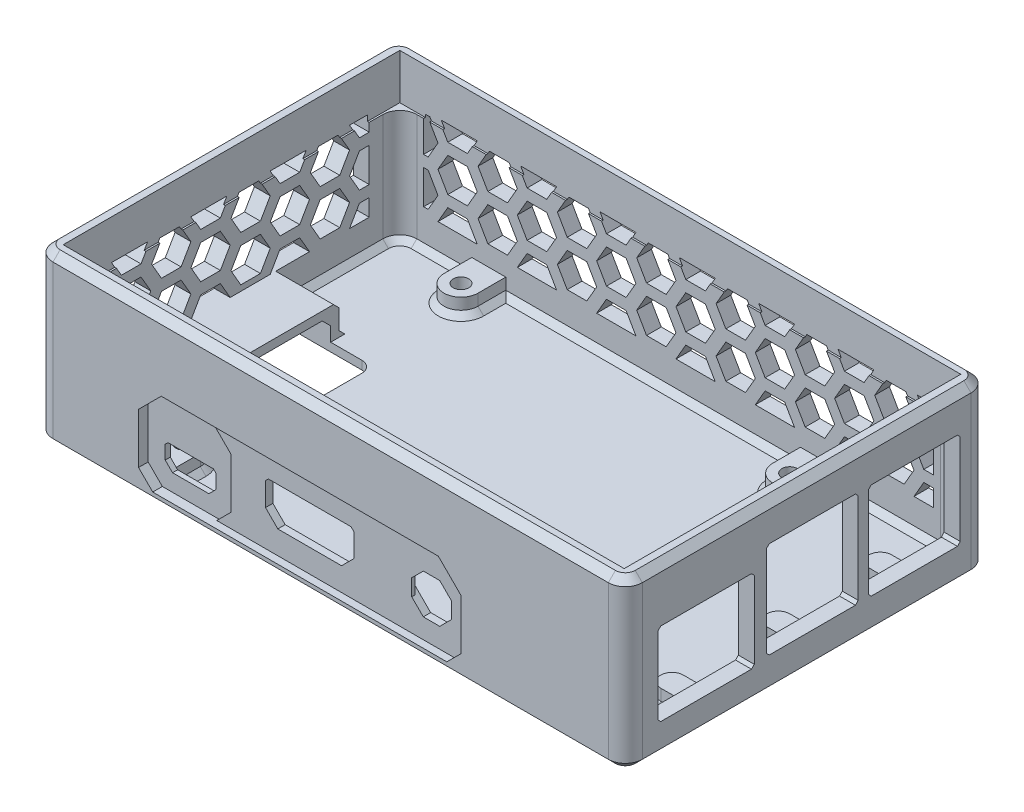
from build123d import *

# Parameters (mm, degrees)
SKETCH2_R               = 1.375
BOSS_EXTRUDE1_DEPTH     = 4.5
BOSS_EXTRUDE1_2_DEPTH   = 4.5
BOSS_EXTRUDE1_3_DEPTH   = 4.5
BOSS_EXTRUDE1_4_DEPTH   = 4.5
SKETCH4_W               = 104
SKETCH4_H               = 64
BOSS_EXTRUDE2_DEPTH     = 1.5
SKETCH5_R               = 2.6
CUT_EXTRUDE1_DEPTH      = 2.5
SKETCH6_W               = 104
SKETCH6_H               = 64
SKETCH6_W_2             = 99
SKETCH6_H_2             = 59.4
BOSS_EXTRUDE3_DEPTH     = 28
BOSS_EXTRUDE4_DEPTH     = 3
SKETCH18_W              = 99
SKETCH18_H              = 59.4
SKETCH18_W_2            = 98.4
SKETCH18_H_2            = 58.8
BOSS_EXTRUDE6_DEPTH     = 20
CUT_EXTRUDE8_DEPTH      = 2.6
CUT_EXTRUDE9_DEPTH      = 10
CUT_EXTRUDE2_DEPTH      = 121.292352209
SKETCH9_W               = 17
SKETCH9_H               = 14.6
SKETCH9_W_2             = 16.2
SKETCH9_H_2             = 17
CUT_EXTRUDE3_DEPTH      = 121.292352209
SKETCH11_W              = 56.9
SKETCH11_H              = 13.9
CUT_EXTRUDE4_DEPTH      = 1.3
SKETCH12_W              = 15
SKETCH12_H              = 13.9
CUT_EXTRUDE5_DEPTH      = 0.4
FILLET1_R               = 3
CHAMFER5_SIZE           = 2.5
CHAMFER1_SIZE           = 0.5
SKETCH20_W              = 13
SKETCH20_H              = 17
BOSS_EXTRUDE7_DEPTH     = 5.5
CHAMFER7_SIZE           = 1.25
CHAMFER3_SIZE           = 1
CUT_EXTRUDE6_DEPTH      = 4
CUT_EXTRUDE6_DEPTH_BACK = 120.933314805
CHAMFER9_SIZE           = 1.5
CHAMFER10_SIZE          = 0.7


with BuildPart() as part:
    # Sketch2 → Boss-Extrude1 (new body)
    with BuildSketch(Plane(origin=(0, 0, 0), x_dir=(1, 0, 0), z_dir=(0, 1, 0))):
        with BuildLine():
            Line((-84.5, -2.5), (-84.5, 3.5))
            ThreePointArc((-84.5, 3.5), (-81.5, 6.5), (-78.5, 3.5))
            Line((-78.5, 3.5), (-78.5, -2.5))
            Line((-78.5, -2.5), (-84.5, -2.5))
        make_face()
        with Locations(Location((-81.5, 3.5, 0), (0, 0, 270))):
            Circle(SKETCH2_R, mode=Mode.SUBTRACT)
    extrude(amount=BOSS_EXTRUDE1_DEPTH)



with BuildPart() as body_2:
    # Sketch2 → Boss-Extrude1 2 (new body)
    with BuildSketch(Plane(origin=(0, 0, 0), x_dir=(1, 0, 0), z_dir=(0, 1, 0))):
        with BuildLine():
            Line((-20.5, -2.5), (-26.5, -2.5))
            Line((-26.5, -2.5), (-26.5, 3.5))
            ThreePointArc((-26.5, 3.5), (-23.5, 6.5), (-20.5, 3.5))
            Line((-20.5, 3.5), (-20.5, -2.5))
        make_face()
        with Locations(Location((-23.5, 3.5, 0), (0, 0, 90))):
            Circle(SKETCH2_R, mode=Mode.SUBTRACT)
    extrude(amount=BOSS_EXTRUDE1_2_DEPTH)


with BuildPart() as body_3:
    # Sketch2 → Boss-Extrude1 3 (new body)
    with BuildSketch(Plane(origin=(0, 0, 0), x_dir=(1, 0, 0), z_dir=(0, 1, 0))):
        with BuildLine():
            Line((-20.5, 58.5), (-20.5, 52.5))
            ThreePointArc((-20.5, 52.5), (-23.5, 49.5), (-26.5, 52.5))
            Line((-26.5, 52.5), (-26.5, 58.5))
            Line((-26.5, 58.5), (-20.5, 58.5))
        make_face()
        with Locations(Location((-23.5, 52.5, 0), (0, 0, 270))):
            Circle(SKETCH2_R, mode=Mode.SUBTRACT)
    extrude(amount=BOSS_EXTRUDE1_3_DEPTH)


with BuildPart() as body_4:
    # Sketch2 → Boss-Extrude1 4 (new body)
    with BuildSketch(Plane(origin=(0, 0, 0), x_dir=(1, 0, 0), z_dir=(0, 1, 0))):
        with BuildLine():
            Line((-84.5, 58.5), (-78.5, 58.5))
            Line((-78.5, 58.5), (-78.5, 52.5))
            ThreePointArc((-78.5, 52.5), (-81.5, 49.5), (-84.5, 52.5))
            Line((-84.5, 52.5), (-84.5, 58.5))
        make_face()
        with Locations(Location((-81.5, 52.5, 0), (0, 0, 90))):
            Circle(SKETCH2_R, mode=Mode.SUBTRACT)
    extrude(amount=BOSS_EXTRUDE1_4_DEPTH)


with BuildPart() as part_1:
    add(part.part)

    add(body_2.part)  # Boss-Extrude2 merges body 2

    add(body_3.part)  # Boss-Extrude2 merges body 3

    add(body_4.part)  # Boss-Extrude2 merges body 4
    # Sketch4 → Boss-Extrude2 (add)
    with BuildSketch(Plane(origin=(0, 0, 0), x_dir=(1, 0, 0), z_dir=(0, 1, 0))):
        with Locations((-48, 28)):
            Rectangle(SKETCH4_W, SKETCH4_H)
    extrude(amount=BOSS_EXTRUDE2_DEPTH)

    # Sketch5 → Cut-Extrude1 (cut)
    with BuildSketch(Plane.XZ):
        with Locations(Location((-81.5, -3.5, 0), (0, 0, 270))):
            Circle(SKETCH5_R)
        with Locations(Location((-23.5, -3.5, 0), (0, 0, 270))):
            Circle(SKETCH5_R)
        with Locations(Location((-23.5, -52.5, 0), (0, 0, 270))):
            Circle(SKETCH5_R)
        with Locations(Location((-81.5, -52.5, 0), (0, 0, 270))):
            Circle(SKETCH5_R)
    extrude(amount=-CUT_EXTRUDE1_DEPTH, mode=Mode.SUBTRACT)

    # Sketch6 → Boss-Extrude3 (add)
    with BuildSketch(Plane(origin=(0, 1.5, 0), x_dir=(1, 0, 0), z_dir=(0, 1, 0))):
        with Locations((-48, 28)):
            Rectangle(SKETCH6_W, SKETCH6_H)
        with Locations((-48, 28)):
            Rectangle(SKETCH6_W_2, SKETCH6_H_2, mode=Mode.SUBTRACT)
    extrude(amount=BOSS_EXTRUDE3_DEPTH)

    # Sketch10 → Boss-Extrude4 (add)
    with BuildSketch(Plane(origin=(0, 1.5, 0), x_dir=(1, 0, 0), z_dir=(0, 1, 0))):
        with BuildLine():
            Line((1.5, 49), (-2, 49))
            ThreePointArc((-2, 49), (-4, 47), (-2, 45))
            Line((-2, 45), (1.5, 45))
            Line((1.5, 45), (1.5, 49))
        make_face()
        with BuildLine():
            Line((1.5, 31), (-2, 31))
            ThreePointArc((-2, 31), (-4, 29), (-2, 27))
            Line((-2, 27), (1.5, 27))
            Line((1.5, 27), (1.5, 31))
        make_face()
        with BuildLine():
            Line((1.5, 12.25), (-2, 12.25))
            ThreePointArc((-2, 12.25), (-4, 10.25), (-2, 8.25))
            Line((-2, 8.25), (1.5, 8.25))
            Line((1.5, 8.25), (1.5, 12.25))
        make_face()
    extrude(amount=BOSS_EXTRUDE4_DEPTH)

    # Sketch18 → Boss-Extrude6 (add)
    with BuildSketch(Plane(origin=(0, 1.5, 0), x_dir=(1, 0, 0), z_dir=(0, 1, 0))):
        with Locations((-48, 28)):
            Rectangle(SKETCH18_W, SKETCH18_H)
        with Locations((-48, 28)):
            Rectangle(SKETCH18_W_2, SKETCH18_H_2, mode=Mode.SUBTRACT)
    extrude(amount=BOSS_EXTRUDE6_DEPTH)

    # Sketch19 → Cut-Extrude8 (cut)
    with BuildSketch(Plane(origin=(0, 0, -60), x_dir=(-1, 0, 0), z_dir=(0, 0, -1))):
        Polygon((3, 7), (6.464101615, 7), (4.732050808, 10), (3, 10), align=None)
        Polygon((3, 18), (3, 12), (4.732050808, 12), (6.464101615, 15), (4.732050808, 18), align=None)
        Polygon((3, 22.5), (3, 20), (4.732050808, 20), (6.175426481, 22.5), align=None)
        Polygon((20.175426481, 22.5), (13.824573519, 22.5), (15.267949192, 20), (18.732050808, 20), align=None)
        Polygon((11.660254038, 16), (13.392304845, 19), (11.660254038, 22), (8.196152423, 22), (6.464101615, 19), (8.196152423, 16), align=None)
        Polygon((11.660254038, 8), (13.392304845, 11), (11.660254038, 14), (8.196152423, 14), (6.464101615, 11), (8.196152423, 8), align=None)
        Polygon((15.267949192, 12), (18.732050808, 12), (20.464101615, 15), (18.732050808, 18), (15.267949192, 18), (13.535898385, 15), align=None)
        Polygon((15.267949192, 10), (13.535898385, 7), (20.464101615, 7), (18.732050808, 10), align=None)
        Polygon((25.660254038, 8), (27.392304845, 11), (25.660254038, 14), (22.196152423, 14), (20.464101615, 11), (22.196152423, 8), align=None)
        Polygon((29.267949192, 10), (27.535898385, 7), (34.464101615, 7), (32.732050808, 10), align=None)
        Polygon((39.660254038, 8), (41.392304845, 11), (39.660254038, 14), (36.196152423, 14), (34.464101615, 11), (36.196152423, 8), align=None)
        Polygon((43.267949192, 10), (41.535898385, 7), (48.464101615, 7), (46.732050808, 10), align=None)
        Polygon((53.660254038, 8), (55.392304845, 11), (53.660254038, 14), (50.196152423, 14), (48.464101615, 11), (50.196152423, 8), align=None)
        Polygon((57.267949192, 10), (55.535898385, 7), (62.464101615, 7), (60.732050808, 10), align=None)
        Polygon((67.660254038, 8), (69.392304845, 11), (67.660254038, 14), (64.196152423, 14), (62.464101615, 11), (64.196152423, 8), align=None)
        Polygon((71.267949192, 10), (69.535898385, 7), (76.464101615, 7), (74.732050808, 10), align=None)
        Polygon((81.660254038, 8), (83.392304845, 11), (81.660254038, 14), (78.196152423, 14), (76.464101615, 11), (78.196152423, 8), align=None)
        Polygon((85.267949192, 10), (83.535898385, 7), (90.464101615, 7), (88.732050808, 10), align=None)
        Polygon((92.196152423, 8), (93, 8), (93, 14), (92.196152423, 14), (90.464101615, 11), align=None)
        Polygon((92.196152423, 16), (93, 16), (93, 22), (92.196152423, 22), (90.464101615, 19), align=None)
        Polygon((90.175426481, 22.5), (83.824573519, 22.5), (85.267949192, 20), (88.732050808, 20), align=None)
        Polygon((85.267949192, 12), (88.732050808, 12), (90.464101615, 15), (88.732050808, 18), (85.267949192, 18), (83.535898385, 15), align=None)
        Polygon((81.660254038, 16), (83.392304845, 19), (81.660254038, 22), (78.196152423, 22), (76.464101615, 19), (78.196152423, 16), align=None)
        Polygon((76.175426481, 22.5), (69.824573519, 22.5), (71.267949192, 20), (74.732050808, 20), align=None)
        Polygon((71.267949192, 12), (74.732050808, 12), (76.464101615, 15), (74.732050808, 18), (71.267949192, 18), (69.535898385, 15), align=None)
        Polygon((67.660254038, 16), (69.392304845, 19), (67.660254038, 22), (64.196152423, 22), (62.464101615, 19), (64.196152423, 16), align=None)
        Polygon((62.175426481, 22.5), (55.824573519, 22.5), (57.267949192, 20), (60.732050808, 20), align=None)
        Polygon((57.267949192, 12), (60.732050808, 12), (62.464101615, 15), (60.732050808, 18), (57.267949192, 18), (55.535898385, 15), align=None)
        Polygon((53.660254038, 16), (55.392304845, 19), (53.660254038, 22), (50.196152423, 22), (48.464101615, 19), (50.196152423, 16), align=None)
        Polygon((48.175426481, 22.5), (41.824573519, 22.5), (43.267949192, 20), (46.732050808, 20), align=None)
        Polygon((34.175426481, 22.5), (27.824573519, 22.5), (29.267949192, 20), (32.732050808, 20), align=None)
        Polygon((25.660254038, 16), (27.392304845, 19), (25.660254038, 22), (22.196152423, 22), (20.464101615, 19), (22.196152423, 16), align=None)
        Polygon((29.267949192, 12), (32.732050808, 12), (34.464101615, 15), (32.732050808, 18), (29.267949192, 18), (27.535898385, 15), align=None)
        Polygon((39.660254038, 16), (41.392304845, 19), (39.660254038, 22), (36.196152423, 22), (34.464101615, 19), (36.196152423, 16), align=None)
        Polygon((43.267949192, 12), (46.732050808, 12), (48.464101615, 15), (46.732050808, 18), (43.267949192, 18), (41.535898385, 15), align=None)
    extrude(amount=-CUT_EXTRUDE8_DEPTH, mode=Mode.SUBTRACT)

    # Sketch21 → Cut-Extrude9 (cut)
    with BuildSketch(Plane.ZY.offset(100)):
        Polygon((-50.267949192, 10), (-52, 10), (-52, 7), (-48.535898385, 7), align=None)
        Polygon((-50.267949192, 18), (-52, 18), (-52, 12), (-50.267949192, 12), (-48.535898385, 15), align=None)
        Polygon((-48.824573519, 22.5), (-52, 22.5), (-52, 20), (-50.267949192, 20), align=None)
        Polygon((-43.339745962, 16), (-41.607695155, 19), (-43.339745962, 22), (-46.803847577, 22), (-48.535898385, 19), (-46.803847577, 16), align=None)
        Polygon((-34.824573519, 22.5), (-41.175426481, 22.5), (-39.732050808, 20), (-36.267949192, 20), align=None)
        Polygon((-29.339745962, 16), (-27.607695155, 19), (-29.339745962, 22), (-32.803847577, 22), (-34.535898385, 19), (-32.803847577, 16), align=None)
        Polygon((-20.824573519, 22.5), (-27.175426481, 22.5), (-25.732050808, 20), (-22.267949192, 20), align=None)
        Polygon((-6.824573519, 22.5), (-13.175426481, 22.5), (-11.732050808, 20), (-8.267949192, 20), align=None)
        Polygon((-4, 16), (-4, 22), (-4.803847577, 22), (-6.535898385, 19), (-4.803847577, 16), align=None)
        Polygon((-4, 8), (-4, 14), (-4.803847577, 14), (-6.535898385, 11), (-4.803847577, 8), align=None)
        Polygon((-11.732050808, 10), (-13.464101615, 7), (-6.535898385, 7), (-8.267949192, 10), align=None)
        Polygon((-25.732050808, 10), (-27.464101615, 7), (-20.535898385, 7), (-22.267949192, 10), align=None)
        Polygon((-39.732050808, 10), (-41.464101615, 7), (-34.535898385, 7), (-36.267949192, 10), align=None)
        Polygon((-43.339745962, 8), (-41.607695155, 11), (-43.339745962, 14), (-46.803847577, 14), (-48.535898385, 11), (-46.803847577, 8), align=None)
        Polygon((-34.535898385, 15), (-36.267949192, 18), (-39.732050808, 18), (-41.464101615, 15), (-39.732050808, 12), (-36.267949192, 12), align=None)
        Polygon((-29.339745962, 8), (-27.607695155, 11), (-29.339745962, 14), (-32.803847577, 14), (-34.535898385, 11), (-32.803847577, 8), align=None)
        Polygon((-20.535898385, 15), (-22.267949192, 18), (-25.732050808, 18), (-27.464101615, 15), (-25.732050808, 12), (-22.267949192, 12), align=None)
        Polygon((-15.339745962, 8), (-13.607695155, 11), (-15.339745962, 14), (-18.803847577, 14), (-20.535898385, 11), (-18.803847577, 8), align=None)
        Polygon((-6.535898385, 15), (-8.267949192, 18), (-11.732050808, 18), (-13.464101615, 15), (-11.732050808, 12), (-8.267949192, 12), align=None)
        Polygon((-15.339745962, 16), (-13.607695155, 19), (-15.339745962, 22), (-18.803847577, 22), (-20.535898385, 19), (-18.803847577, 16), align=None)
    extrude(amount=-CUT_EXTRUDE9_DEPTH, mode=Mode.SUBTRACT)

    # Sketch8 → Cut-Extrude2 (cut, through all)
    with BuildSketch(Plane.XY):
        Polygon((-60.8, 12.8), (-45.2, 12.8), (-45.2, 8.175735931), (-47.375735931, 6), (-58.624264069, 6), (-60.8, 8.175735931), align=None)
        Polygon((-78.9, 9.1), (-69.9, 9.1), (-69.9, 6.192893219), (-71.192893219, 4.9), (-77.607106781, 4.9), (-78.9, 6.192893219), align=None)
        Polygon((-28, 10.349747468), (-30.050252532, 12.4), (-32.949747468, 12.4), (-35, 10.349747468), (-35, 7.450252532), (-32.949747468, 5.4), (-30.050252532, 5.4), (-28, 7.450252532), align=None)
    extrude(amount=CUT_EXTRUDE2_DEPTH, mode=Mode.SUBTRACT)

    # Sketch9 → Cut-Extrude3 (cut, through all)
    with BuildSketch(Plane(origin=(0, 0, 0), x_dir=(0, 0, -1), z_dir=(1, 0, 0))):
        with Locations((10.25, 12.7)):
            Rectangle(SKETCH9_W, SKETCH9_H)
        with Locations((29, 14.5)):
            Rectangle(SKETCH9_W_2, SKETCH9_H_2)
        with Locations((47, 14.5)):
            Rectangle(SKETCH9_W_2, SKETCH9_H_2)
    extrude(amount=CUT_EXTRUDE3_DEPTH, mode=Mode.SUBTRACT)

    # Sketch11 → Cut-Extrude4 (cut)
    with BuildSketch(Plane.XY.offset(4)):
        with Locations((-53.45, 8.85)):
            Rectangle(SKETCH11_W, SKETCH11_H)
    extrude(amount=-CUT_EXTRUDE4_DEPTH, mode=Mode.SUBTRACT)

    # Sketch12 → Cut-Extrude5 (cut)
    with BuildSketch(Plane.XY.offset(2.7)):
        with Locations((-74.4, 8.85)):
            Rectangle(SKETCH12_W, SKETCH12_H)
    extrude(amount=-CUT_EXTRUDE5_DEPTH, mode=Mode.SUBTRACT)

    # Fillet1
    fillet1_edges = [part_1.edges().sort_by_distance(p)[0] for p in [
        (-100, 14.75, -60),
        (4, 14.75, -60),
        (-100, 14.75, 4),
        (4, 14.75, 4),
        (1.2, 11.5, 1.4),
        (1.2, 11.5, -57.4),
        (-97.2, 11.5, -57.4),
        (-97.2, 11.5, 1.4),
    ]]
    fillet(fillet1_edges, radius=FILLET1_R)

    # Chamfer5
    chamfer5_edges = [part_1.edges().sort_by_distance(p)[0] for p in [
        (-81.9, 1.9, 3.15),
        (-81.9, 15.8, 3.15),
        (-25, 15.8, 3.35),
        (-25, 1.9, 3.35),
        (-66.9, 15.8, 2.5),
        (-66.9, 1.9, 2.5),
    ]]
    chamfer(chamfer5_edges, length=CHAMFER5_SIZE)

    # Chamfer1
    chamfer1_edges = [part_1.edges().sort_by_distance(p)[0] for p in [
        (2.6, 20, -18.75),
        (2.6, 20, -1.75),
        (2.6, 5.4, -1.75),
        (2.6, 5.4, -18.75),
        (2.75, 23, -37.1),
        (2.75, 23, -20.9),
        (2.6, 6, -20.9),
        (2.6, 6, -37.1),
        (2.75, 23, -55.1),
        (2.75, 23, -38.9),
        (2.6, 6, -38.9),
        (2.558595215, 6, -55.1),
        (-45.2, 12.8, 2.05),
        (-60.8, 12.8, 2.05),
        (-69.9, 9.1, 1.85),
        (-78.9, 9.1, 1.85),
    ]]
    chamfer(chamfer1_edges, length=CHAMFER1_SIZE)

    # Sketch20 → Boss-Extrude7 (add)
    with BuildSketch(Plane(origin=(0, 1.5, 0), x_dir=(1, 0, 0), z_dir=(0, 1, 0))):
        with Locations((-93.5, 28)):
            Rectangle(SKETCH20_W, SKETCH20_H)
    extrude(amount=BOSS_EXTRUDE7_DEPTH)

    # Chamfer7
    chamfer7_edges = [part_1.edges().sort_by_distance(p)[0] for p in [
        (-100, 0, -28),
        (-100, 29.5, -28),
        (-48, 0, -60),
        (4, 0, -28),
        (-48, 0, 4),
        (3.121320344, 0, 3.121320344),
        (-99.121320344, 0, 3.121320344),
        (3.121320344, 0, -59.121320344),
        (-99.121320344, 0, -59.121320344),
        (-48, 29.5, -60),
        (-48, 29.5, 4),
        (4, 29.5, -28),
        (3.121320344, 29.5, 3.121320344),
        (-99.121320344, 29.5, 3.121320344),
        (3.121320344, 29.5, -59.121320344),
        (-99.121320344, 29.5, -59.121320344),
    ]]
    chamfer(chamfer7_edges, length=CHAMFER7_SIZE)

    # Chamfer3
    chamfer3_edges = [part_1.edges().sort_by_distance(p)[0] for p in [
        (-89.35, 1.5, 1.4),
        (1.2, 1.5, -4.925),
        (-11.15, 1.5, -57.4),
        (-97.2, 1.5, -45.45),
        (-96.321320344, 1.5, 0.521320344),
        (-96.321320344, 1.5, -56.521320344),
        (0.321320344, 1.5, -56.521320344),
        (0.321320344, 1.5, 0.521320344),
        (-0.4, 1.5, -45),
        (-4, 1.5, -47),
        (-0.4, 1.5, -27),
        (-4, 1.5, -29),
        (-97.2, 1.5, -10.55),
        (-92.1, 1.5, -19.5),
        (-92.1, 1.5, -36.5),
        (-92.1, 7, -36.5),
        (-92.1, 7, -19.5),
        (-0.4, 1.5, -8.25),
        (-4, 1.5, -10.25),
        (-84.5, 1.5, -1.05),
        (-0.4, 1.5, -12.25),
        (-81.5, 1.5, -6.5),
        (-0.4, 1.5, -31),
        (-0.4, 1.5, -49),
        (-78.5, 1.5, -54.95),
        (-20.5, 1.5, -54.95),
        (-26.5, 1.5, -1.05),
        (-78.5, 1.5, -1.05),
        (-52.5, 1.5, 1.4),
        (-89.35, 1.5, -57.4),
        (-11.15, 1.5, 1.4),
        (1.2, 1.5, -51.7),
        (-52.5, 1.5, -57.4),
        (1.2, 1.5, -38),
        (1.2, 1.5, -19.625),
        (-23.5, 1.5, -6.5),
        (-20.5, 1.5, -1.05),
        (-23.5, 1.5, -49.5),
        (-26.5, 1.5, -54.95),
        (-81.5, 1.5, -49.5),
        (-84.5, 1.5, -54.95),
    ]]
    chamfer(chamfer3_edges, length=CHAMFER3_SIZE)

    # Sketch14 → Cut-Extrude6 (cut, two sides: drawn at the far end of the back side and taken through both)
    with BuildSketch(Plane(origin=(0, 1.5, 0), x_dir=(1, 0, 0), z_dir=(0, 1, 0)).offset(-CUT_EXTRUDE6_DEPTH_BACK)):
        with BuildLine():
            Line((-79.5, 33), (-79.5, 23))
            ThreePointArc((-79.5, 23), (-80.085786438, 21.585786438), (-81.5, 21))
            Line((-81.5, 21), (-100, 21))
            Line((-100, 21), (-100, 35))
            Line((-100, 35), (-81.5, 35))
            ThreePointArc((-81.5, 35), (-80.085786438, 34.414213562), (-79.5, 33))
        make_face()
    extrude(amount=CUT_EXTRUDE6_DEPTH + CUT_EXTRUDE6_DEPTH_BACK, mode=Mode.SUBTRACT)

    # Chamfer9
    # the kernel refuses this chamfer: 1.5 mm, written as the material it adds along each edge
    with BuildSketch(Plane(origin=(-87, 5.5, -21), x_dir=(0, -0.9996219169112968, 0.027495876610586775), z_dir=(-1, 0, 0)), Plane(origin=(-100, 5.5, -35), x_dir=(0, -0.9996219169112968, -0.027495876610586775), z_dir=(1, 0, 0))) as chamfer9_piece_1:
        Polygon((CHAMFER9_SIZE * 0.999621916911, -CHAMFER9_SIZE * 0.0274958766106), (-CHAMFER9_SIZE * 0.0274958766106, -CHAMFER9_SIZE * 0.999621916911), (0, 0), align=None)
    extrude(amount=13)
    # the kernel refuses this chamfer: 1.5 mm, written as the material it takes off along each edge
    with BuildSketch(Plane(origin=(-83.257524482, 15.8, 4), x_dir=(0, 0.9996219169112968, 0.027495876610586223), z_dir=(1, 0, 0))) as chamfer9_2_piece_1_section:
        Polygon((CHAMFER9_SIZE * 0.999621916911, -CHAMFER9_SIZE * 0.0274958766106), (-CHAMFER9_SIZE * 0.0274958766106, -CHAMFER9_SIZE * 0.999621916911), (0, 0), align=None)
    chamfer9_2_piece_1 = extrude(amount=59.615048964, mode=Mode.PRIVATE)
    chamfer9_2_piece_1 = split(chamfer9_2_piece_1, bisect_by=Plane(origin=(-74.4, 16.276865215, 2.7), z_dir=(0, 0, 1)), keep=Keep.TOP, mode=Mode.PRIVATE)
    chamfer9_2_piece_1 = split(chamfer9_2_piece_1, bisect_by=Plane(origin=(-76.661567393, 18.538432607, 3.516149063), z_dir=(0.7071067811865476, -0.7071067811865476, 0)), keep=Keep.TOP, mode=Mode.PRIVATE)
    chamfer9_2_piece_1 = split(chamfer9_2_piece_1, bisect_by=Plane(origin=(-72.138432607, 18.538432607, 3.516149063), z_dir=(-0.7071067811865476, -0.7071067811865476, 0)), keep=Keep.TOP, mode=Mode.PRIVATE)
    add(chamfer9_2_piece_1, mode=Mode.SUBTRACT)
    with BuildSketch(Plane(origin=(-83.257524482, 15.8, 4), x_dir=(0, 0.9996219169112968, 0.027495876610586223), z_dir=(1, 0, 0))) as chamfer9_2_piece_2_section:
        Polygon((CHAMFER9_SIZE * 0.999621916911, -CHAMFER9_SIZE * 0.0274958766106), (-CHAMFER9_SIZE * 0.0274958766106, -CHAMFER9_SIZE * 0.999621916911), (0, 0), align=None)
    chamfer9_2_piece_2 = extrude(amount=59.615048964, mode=Mode.PRIVATE)
    chamfer9_2_piece_2 = split(chamfer9_2_piece_2, bisect_by=Plane(origin=(-74.4, 15.824226738, 2.7), z_dir=(0, 0, -1)), keep=Keep.TOP, mode=Mode.PRIVATE)
    chamfer9_2_piece_2 = split(chamfer9_2_piece_2, bisect_by=Plane(origin=(-76.887886631, 18.312113369, 2.610330737), z_dir=(0.7071067811865476, -0.7071067811865476, 0)), keep=Keep.TOP, mode=Mode.PRIVATE)
    chamfer9_2_piece_2 = split(chamfer9_2_piece_2, bisect_by=Plane(origin=(-71.912113369, 18.312113369, 2.610330737), z_dir=(-0.7071067811865476, -0.7071067811865476, 0)), keep=Keep.TOP, mode=Mode.PRIVATE)
    add(chamfer9_2_piece_2, mode=Mode.SUBTRACT)
    with BuildSketch(Plane(origin=(-83.257524482, 15.8, 4), x_dir=(0, 0.9996219169112968, 0.027495876610586223), z_dir=(1, 0, 0))) as chamfer9_2_piece_3_section:
        Polygon((CHAMFER9_SIZE * 0.999621916911, -CHAMFER9_SIZE * 0.0274958766106), (-CHAMFER9_SIZE * 0.0274958766106, -CHAMFER9_SIZE * 0.999621916911), (0, 0), align=None)
    chamfer9_2_piece_3 = extrude(amount=59.615048964, mode=Mode.PRIVATE)
    chamfer9_2_piece_3 = split(chamfer9_2_piece_3, bisect_by=Plane(origin=(-48.958114685, 16.308114685, 2.7), z_dir=(0, 0, 1)), keep=Keep.TOP, mode=Mode.PRIVATE)
    chamfer9_2_piece_3 = split(chamfer9_2_piece_3, bisect_by=Plane(origin=(-59.433114685, 5.833114685, 3.530877018), z_dir=(0.7071067811865476, 0.7071067811865476, 0)), keep=Keep.TOP, mode=Mode.PRIVATE)
    chamfer9_2_piece_3 = split(chamfer9_2_piece_3, bisect_by=Plane(origin=(-38.483114685, 26.783114685, 3.530877018), z_dir=(-0.7071067811865476, -0.7071067811865476, 0)), keep=Keep.TOP, mode=Mode.PRIVATE)
    add(chamfer9_2_piece_3, mode=Mode.SUBTRACT)

    # Chamfer10
    chamfer10_edges = [part_1.edges().sort_by_distance(p)[0] for p in [
        (-35, 8.9, 1.4),
        (-33.974873734, 11.374873734, 1.4),
        (-31.5, 12.4, 1.4),
        (-29.025126266, 11.374873734, 1.4),
    ]]
    chamfer(chamfer10_edges, length=CHAMFER10_SIZE)


solid = part_1.part
